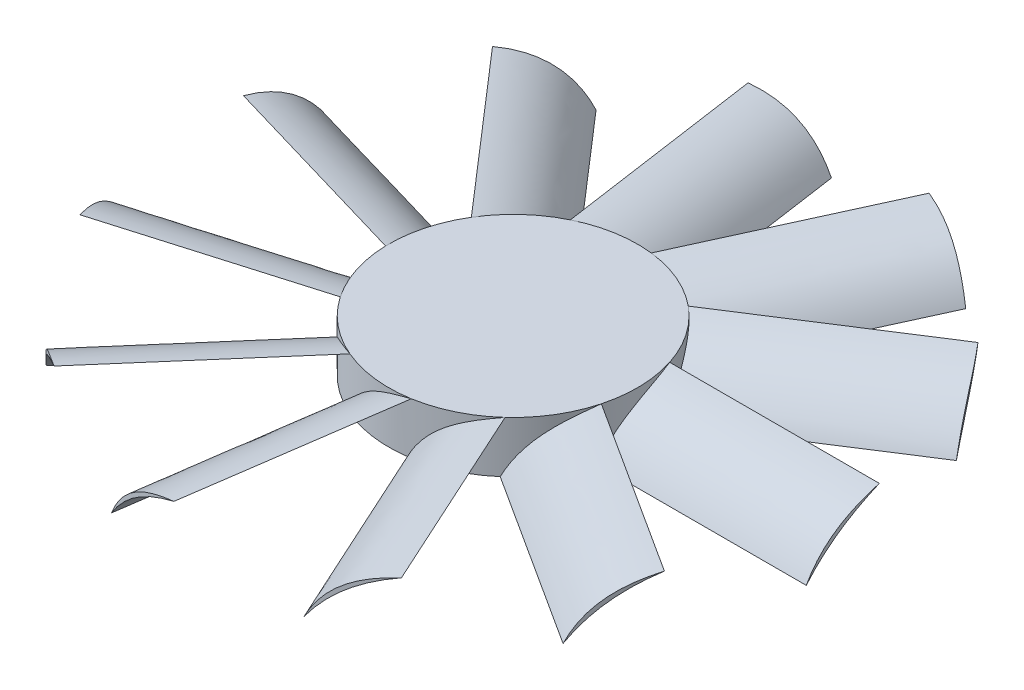
from build123d import *
from build123d.topology import SkipClean

# Parameters (mm, degrees)
SKETCH1_R           = 14.5
SKETCH1_R_2         = 11.5
BOSS_EXTRUDE1_DEPTH = 6
BOSS_EXTRUDE3_START = -1
SKETCH3_R           = 11.5
BOSS_EXTRUDE3_DEPTH = 1
BOSS_EXTRUDE4_DEPTH = 48
CIRPATTERN1_COUNT   = 11
SKETCH6_R           = 11.5
CUT_EXTRUDE1_DEPTH  = 5
SKETCH7_R           = 49.891123866
SKETCH7_R_2         = 38.5
CUT_EXTRUDE2_DEPTH  = 48
SKETCH8_R           = 1
BOSS_EXTRUDE5_DEPTH = 8.5
SKETCH10_W          = 0.25
SKETCH10_H          = 0.3
CHAMFER1_SIZE       = 0.5


with BuildPart() as part:
    # Sketch1 → Boss-Extrude1 (new body)
    with BuildSketch(Plane(origin=(0, 0, 0), x_dir=(1, 0, 0), z_dir=(0, 1, 0))):
        Circle(SKETCH1_R)
        Circle(SKETCH1_R_2, mode=Mode.SUBTRACT)
    extrude(amount=BOSS_EXTRUDE1_DEPTH)

    # Sketch3 → Boss-Extrude3 (add)
    with BuildSketch(Plane(origin=(0, 6, 0), x_dir=(1, 0, 0), z_dir=(0, 1, 0)).offset(BOSS_EXTRUDE3_START)):
        Circle(SKETCH3_R)
    extrude(amount=BOSS_EXTRUDE3_DEPTH)

    # Sketch5 → Boss-Extrude4 (add)
    with SkipClean():  # the faces are left unmerged after this step: merging them gives an invalid solid
        with BuildSketch(Plane(origin=(0, 0, 0), x_dir=(0, 0, -1), z_dir=(1, 0, 0))):
            with BuildLine():
                add(Edge.make_bspline(
                    [(4.439445179, 6), (-0.894939053, 4.58743054), (-4.115494584, 0)],
                    knots=[0, 0, 0, 1, 1, 1], degree=2))
                add(Edge.make_bspline(
                    [(4.439445179, 6), (-1.668362646, 5.166392885), (-4.115494584, 0)],
                    knots=[0, 0, 0, 1, 1, 1], degree=2))
            make_face()
        boss_extrude4 = extrude(amount=BOSS_EXTRUDE4_DEPTH)

    # CirPattern1: Boss-Extrude4 ×11 about axis
    cirpattern1_axis = Axis((0, 6, 0), (0, 1, 0))
    for i in range(1, CIRPATTERN1_COUNT):
        add(boss_extrude4.rotate(cirpattern1_axis, i * 360 / CIRPATTERN1_COUNT))

    # Sketch6 → Cut-Extrude1 (cut)
    with BuildSketch(Plane.XZ):
        Circle(SKETCH6_R)
    extrude(amount=-CUT_EXTRUDE1_DEPTH, mode=Mode.SUBTRACT)

    # Sketch7 → Cut-Extrude2 (cut)
    with BuildSketch(Plane(origin=(0, 6, 0), x_dir=(1, 0, 0), z_dir=(0, 1, 0))):
        Circle(SKETCH7_R)
        Circle(SKETCH7_R_2, mode=Mode.SUBTRACT)
    extrude(amount=-CUT_EXTRUDE2_DEPTH, mode=Mode.SUBTRACT)

    # Sketch8 → Boss-Extrude5 (add)
    with BuildSketch(Plane.XZ.offset(-5)):
        Circle(SKETCH8_R)
    extrude(amount=BOSS_EXTRUDE5_DEPTH)

    # Sketch10 → Cut-Revolve1 (revolve, cut)
    with BuildSketch(Plane(origin=(0, 0, 0), x_dir=(0, 0, -1), z_dir=(1, 0, 0))):
        with Locations((-0.875, -2.35)):
            Rectangle(SKETCH10_W, SKETCH10_H)
    revolve(axis=Axis((0, -3.5, 0), (0, 1, 0)), mode=Mode.SUBTRACT)

    # Chamfer1
    chamfer1_edges = [part.edges().sort_by_distance(p)[0] for p in [
        (-1, -3.5, 0),
    ]]
    chamfer(chamfer1_edges, length=CHAMFER1_SIZE)


solid = part.part
